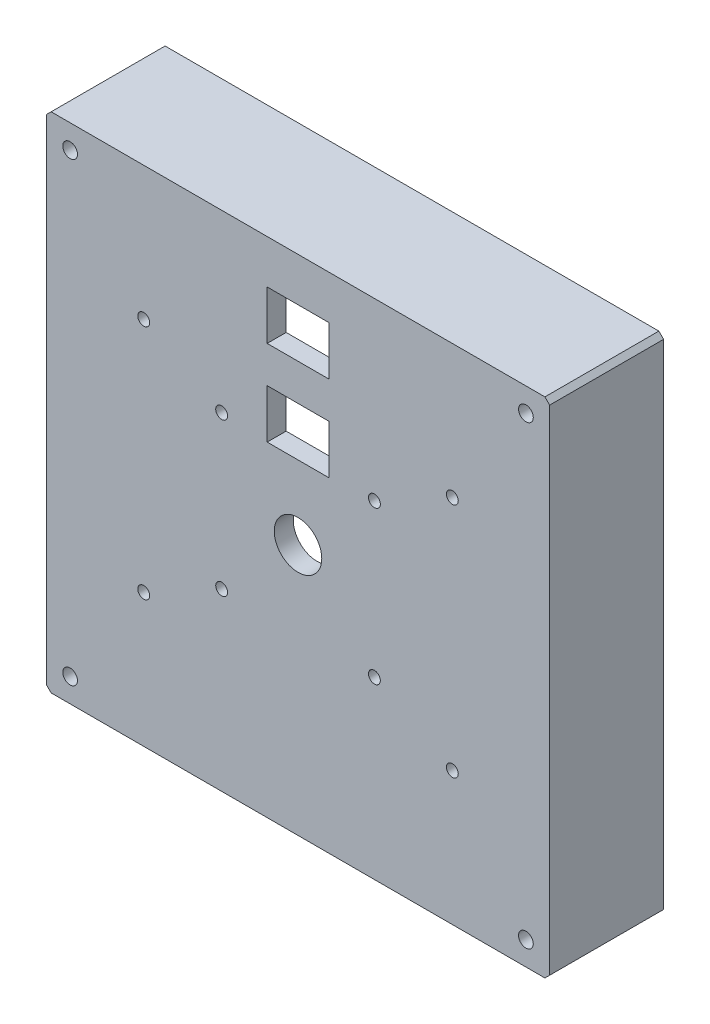
from build123d import *

# Parameters (mm, degrees)
SKETCH1_W               = 106
SKETCH1_H               = 106
BOSS_EXTRUDE1_DEPTH     = 4
SKETCH2_W               = 106
SKETCH2_H               = 106
BOSS_EXTRUDE2_DEPTH     = 20
SKETCH7_R               = 1.55
CUT_EXTRUDE2_DEPTH      = 50
SKETCH8_R               = 1.25
SKETCH8_R_2             = 5
SKETCH8_W               = 13
SKETCH8_H               = 10.3
CUT_EXTRUDE3_DEPTH      = 10
SKETCH9_R               = 4.5
BOSS_EXTRUDE3_DEPTH     = 4
SKETCH14_R              = 2.5
SKETCH14_W              = 13
SKETCH14_H              = 8
CUT_EXTRUDE4_DEPTH      = 10
CHAMFER1_SIZE           = 1
CHAMFER2_SIZE           = 1
CUT_EXTRUDE5_DEPTH      = 97
CUT_EXTRUDE5_DEPTH_BACK = 1
SKETCH15_R              = 1.6
CHAMFER3_SIZE           = 1


with BuildPart() as part:
    # Sketch1 → Boss-Extrude1 (new body)
    with BuildSketch(Plane.XY):
        Rectangle(SKETCH1_W, SKETCH1_H)
    extrude(amount=-BOSS_EXTRUDE1_DEPTH)

    # Sketch2 → Boss-Extrude2 (add)
    with BuildSketch(Plane(origin=(0, 0, -4), x_dir=(-1, 0, 0), z_dir=(0, 0, -1))):
        Rectangle(SKETCH2_W, SKETCH2_H)
        Polygon((-48, 41), (-48, -41), (-41, -48), (41, -48), (48, -41), (48, 41), (41, 48), (-41, 48), align=None, mode=Mode.SUBTRACT)
    extrude(amount=BOSS_EXTRUDE2_DEPTH)

    # Sketch7 → Cut-Extrude2 (cut)
    with BuildSketch(Plane.XY):
        with Locations((-48, 48)):
            Circle(SKETCH7_R)
        with Locations((48, 48)):
            Circle(SKETCH7_R)
        with Locations((-48, -48)):
            Circle(SKETCH7_R)
        with Locations((48, -48)):
            Circle(SKETCH7_R)
    extrude(amount=-CUT_EXTRUDE2_DEPTH, mode=Mode.SUBTRACT)

    # Sketch8 → Cut-Extrude3 (cut)
    with BuildSketch(Plane.XY):
        with Locations((32.5, 24.9)):
            Circle(SKETCH8_R)
        with Locations((-32.5, 24.9)):
            Circle(SKETCH8_R)
        with Locations((-32.5, -24.9)):
            Circle(SKETCH8_R)
        with Locations((32.5, -24.9)):
            Circle(SKETCH8_R)
        with Locations((16.086679272, -16.086679272)):
            Circle(SKETCH8_R)
        with Locations((-16.086679272, -16.086679272)):
            Circle(SKETCH8_R)
        with Locations((16.086679272, 16.086679272)):
            Circle(SKETCH8_R)
        with Locations((-16.086679272, 16.086679272)):
            Circle(SKETCH8_R)
        Circle(SKETCH8_R_2)
        with Locations((0, 38.65)):
            Rectangle(SKETCH8_W, SKETCH8_H)
        with Locations((0, 20.65)):
            Rectangle(SKETCH8_W, SKETCH8_H)
    extrude(amount=-CUT_EXTRUDE3_DEPTH, mode=Mode.SUBTRACT)

    # Sketch9 → Boss-Extrude3 (add)
    # profile 1 of 4: a face of its own
    with BuildSketch(Plane.XY.offset(-4)):
        with Locations((-34.5, 41)):
            Circle(SKETCH9_R)
        Polygon((-35.701219331, 38.1), (-33.298780669, 38.1), (-31.6, 39.798780669), (-31.6, 42.201219331), (-33.298780669, 43.9), (-35.701219331, 43.9), (-37.4, 42.201219331), (-37.4, 39.798780669), align=None, mode=Mode.SUBTRACT)
    # profile 2 of 4: a face of its own
    with BuildSketch(Plane.XY.offset(-4)):
        with Locations((34.5, 41)):
            Circle(SKETCH9_R)
        Polygon((37.4, 39.798780669), (35.701219331, 38.1), (33.298780669, 38.1), (31.6, 39.798780669), (31.6, 42.201219331), (33.298780669, 43.9), (35.701219331, 43.9), (37.4, 42.201219331), align=None, mode=Mode.SUBTRACT)
    # profile 3 of 4: a face of its own
    with BuildSketch(Plane.XY.offset(-4)):
        with Locations((34.5, -41)):
            Circle(SKETCH9_R)
        Polygon((35.701219331, -38.1), (33.298780669, -38.1), (31.6, -39.798780669), (31.6, -42.201219331), (33.298780669, -43.9), (35.701219331, -43.9), (37.4, -42.201219331), (37.4, -39.798780669), align=None, mode=Mode.SUBTRACT)
    # profile 4 of 4: a face of its own
    with BuildSketch(Plane.XY.offset(-4)):
        with Locations((-34.5, -41)):
            Circle(SKETCH9_R)
        Polygon((-37.4, -39.798780669), (-35.701219331, -38.1), (-33.298780669, -38.1), (-31.6, -39.798780669), (-31.6, -42.201219331), (-33.298780669, -43.9), (-35.701219331, -43.9), (-37.4, -42.201219331), align=None, mode=Mode.SUBTRACT)
    extrude(amount=-BOSS_EXTRUDE3_DEPTH)

    # Sketch14 → Cut-Extrude4 (cut)
    with BuildSketch(Plane.XZ.offset(53)):
        with Locations((-20, -10.83)):
            Circle(SKETCH14_R)
        with Locations((0, -10.83)):
            Rectangle(SKETCH14_W, SKETCH14_H)
    extrude(amount=-CUT_EXTRUDE4_DEPTH, mode=Mode.SUBTRACT)

    # Chamfer1
    chamfer1_edges = [part.edges().sort_by_distance(p)[0] for p in [
        (53, 53, -12),
        (-53, 53, -12),
        (-53, -53, -12),
        (53, -53, -12),
    ]]
    chamfer(chamfer1_edges, length=CHAMFER1_SIZE)

    # Chamfer2
    chamfer2_edges = [part.edges().sort_by_distance(p)[0] for p in [
        (0, -53, -6.83),
        (6.5, -53, -10.83),
        (0, -53, -14.83),
        (-6.5, -53, -10.83),
    ]]
    chamfer(chamfer2_edges, length=CHAMFER2_SIZE)

    # Sketch15 → Cut-Extrude5 (cut, two sides: drawn at the far end of the back side and taken through both)
    with BuildSketch(Plane.ZY.offset(-48).offset(-CUT_EXTRUDE5_DEPTH_BACK)):
        with Locations((-12, -23)):
            Circle(SKETCH15_R)
        with Locations((-12, 23)):
            Circle(SKETCH15_R)
    extrude(amount=CUT_EXTRUDE5_DEPTH + CUT_EXTRUDE5_DEPTH_BACK, mode=Mode.SUBTRACT)

    # Chamfer3
    chamfer3_edges = [part.edges().sort_by_distance(p)[0] for p in [
        (-22.5, -48, -10.83),
        (-22.5, -53, -10.83),
    ]]
    chamfer(chamfer3_edges, length=CHAMFER3_SIZE)


solid = part.part
